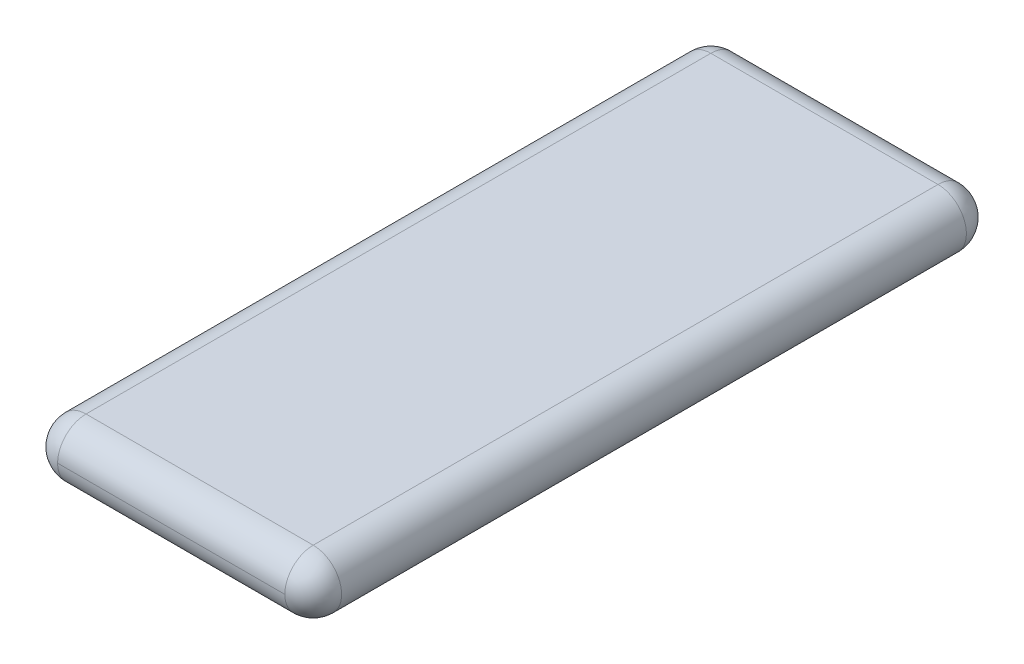
from build123d import *

# Parameters (mm, degrees)
BOSS_EXTRUDE1_DEPTH = 120
FILLET1_R           = 5


with BuildPart() as part:
    # Sketch1 → Boss-Extrude1 (new body)
    with BuildSketch(Plane.XY):
        with BuildLine():
            Line((0, 5), (40, 5))
            ThreePointArc((40, 5), (45, 0), (40, -5))
            Line((40, -5), (0, -5))
            ThreePointArc((0, -5), (-5, 0), (0, 5))
        make_face()
    extrude(amount=BOSS_EXTRUDE1_DEPTH)

    # Fillet1
    fillet1_edges = [part.edges().sort_by_distance(p)[0] for p in [
        (45, 0, 120),
        (20, 5, 120),
        (-5, 0, 120),
        (20, 5, 0),
        (45, 0, 0),
        (20, -5, 0),
        (-5, 0, 0),
        (20, -5, 120),
    ]]
    fillet(fillet1_edges, radius=FILLET1_R - 0.0001)  # a hair under: the kernel refuses the full size


solid = part.part
